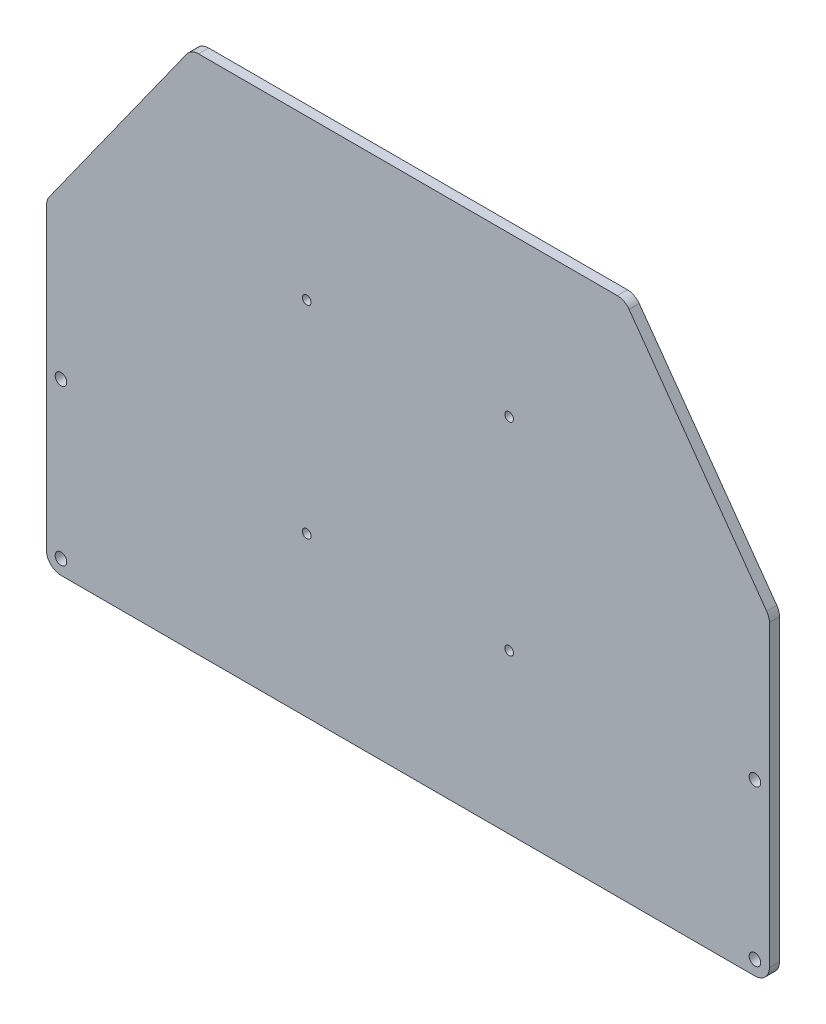
from build123d import *

# Parameters (mm, degrees)
BOSS_EXTRU_1_DEPTH           = 3.5
ESQUISSE2_R                  = 2
ENL_V_MAT_EXTRU_1_DEPTH      = 395.382111663
ENL_V_MAT_EXTRU_2_DEPTH      = 395.382111663
ENL_V_MAT_EXTRU_2_DEPTH_BACK = 395.382111663
CONG_1_R                     = 5
ESQUISSE4_R                  = 1.5
ENL_V_MAT_EXTRU_3_DEPTH      = 309.078317965


with BuildPart() as part:
    # Esquisse1 → Boss.-Extru.1 (new body)
    with BuildSketch(Plane.XY):
        with BuildLine():
            Line((5, 0), (245, 0))
            ThreePointArc((245, 0), (248.535533906, 1.464466094), (250, 5))
            Line((250, 5), (250, 305))
            Line((250, 305), (0, 305))
            Line((0, 305), (0, 5))
            ThreePointArc((0, 5), (1.464466094, 1.464466094), (5, 0))
        make_face()
    extrude(amount=BOSS_EXTRU_1_DEPTH)

    # Esquisse2 → Enlèv. mat.-Extru.1 (cut, through all)
    with BuildSketch(Plane.XY.offset(3.5)):
        with Locations((5, 5)):
            Circle(ESQUISSE2_R)
        with Locations((245, 5)):
            Circle(ESQUISSE2_R)
        with Locations((5, 58.8)):
            Circle(ESQUISSE2_R)
        with Locations((245, 58.8)):
            Circle(ESQUISSE2_R)
    extrude(amount=-ENL_V_MAT_EXTRU_1_DEPTH, mode=Mode.SUBTRACT)

    # Esquisse3 → Enlèv. mat.-Extru.2 (cut, two sides: drawn at the far end of the back side and taken through both)
    with BuildSketch(Plane.XY.offset(3.5).offset(-ENL_V_MAT_EXTRU_2_DEPTH_BACK)):
        Polygon((-374.383398967, -414.136758554), (0, 110), (50, 180), (200, 180), (250, 110), (624.383398967, -414.136758554), (624.383398967, 874.090350445), (-374.383398967, 874.090350445), align=None)
    extrude(amount=ENL_V_MAT_EXTRU_2_DEPTH + ENL_V_MAT_EXTRU_2_DEPTH_BACK, mode=Mode.SUBTRACT)

    # Congé1
    cong_1_edges = [part.edges().sort_by_distance(p)[0] for p in [
        (250, 110, 1.75),
        (200, 180, 1.75),
        (50, 180, 1.75),
        (0, 110, 1.75),
    ]]
    fillet(cong_1_edges, radius=CONG_1_R)

    # Esquisse4 → Enlèv. mat.-Extru.3 (cut, through all)
    with BuildSketch(Plane(origin=(0, 0, 0), x_dir=(-1, 0, 0), z_dir=(0, 0, -1))):
        with Locations((-160, 55)):
            Circle(ESQUISSE4_R)
        with Locations((-160, 125)):
            Circle(ESQUISSE4_R)
        with Locations((-90, 125)):
            Circle(ESQUISSE4_R)
        with Locations((-90, 55)):
            Circle(ESQUISSE4_R)
    extrude(amount=-ENL_V_MAT_EXTRU_3_DEPTH, mode=Mode.SUBTRACT)


solid = part.part
